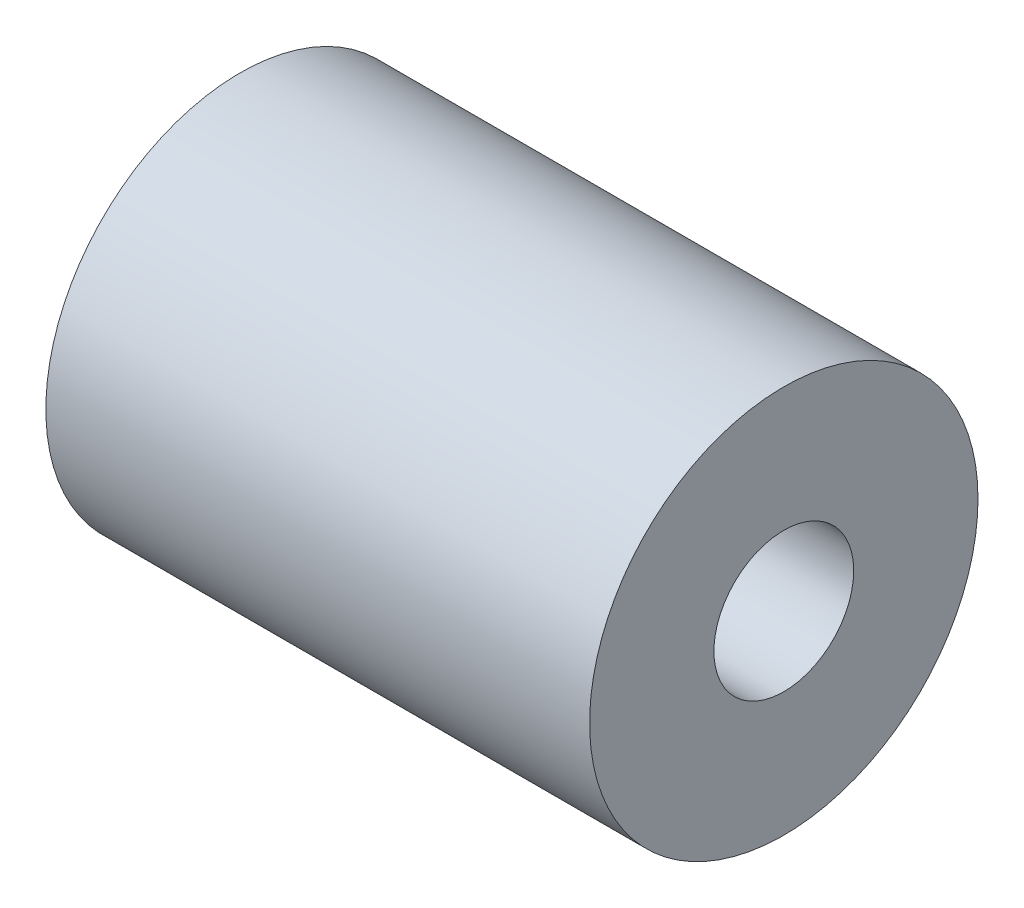
from build123d import *

# Parameters (mm, degrees)
SKETCH1_R           = 5
SKETCH1_R_2         = 1.8
BOSS_EXTRUDE1_DEPTH = 14


with BuildPart() as part:
    # Sketch1 → Boss-Extrude1 (new body)
    with BuildSketch(Plane(origin=(0, 0, 0), x_dir=(0, 0, -1), z_dir=(1, 0, 0))):
        Circle(SKETCH1_R)
        Circle(SKETCH1_R_2, mode=Mode.SUBTRACT)
    extrude(amount=BOSS_EXTRUDE1_DEPTH)


solid = part.part
